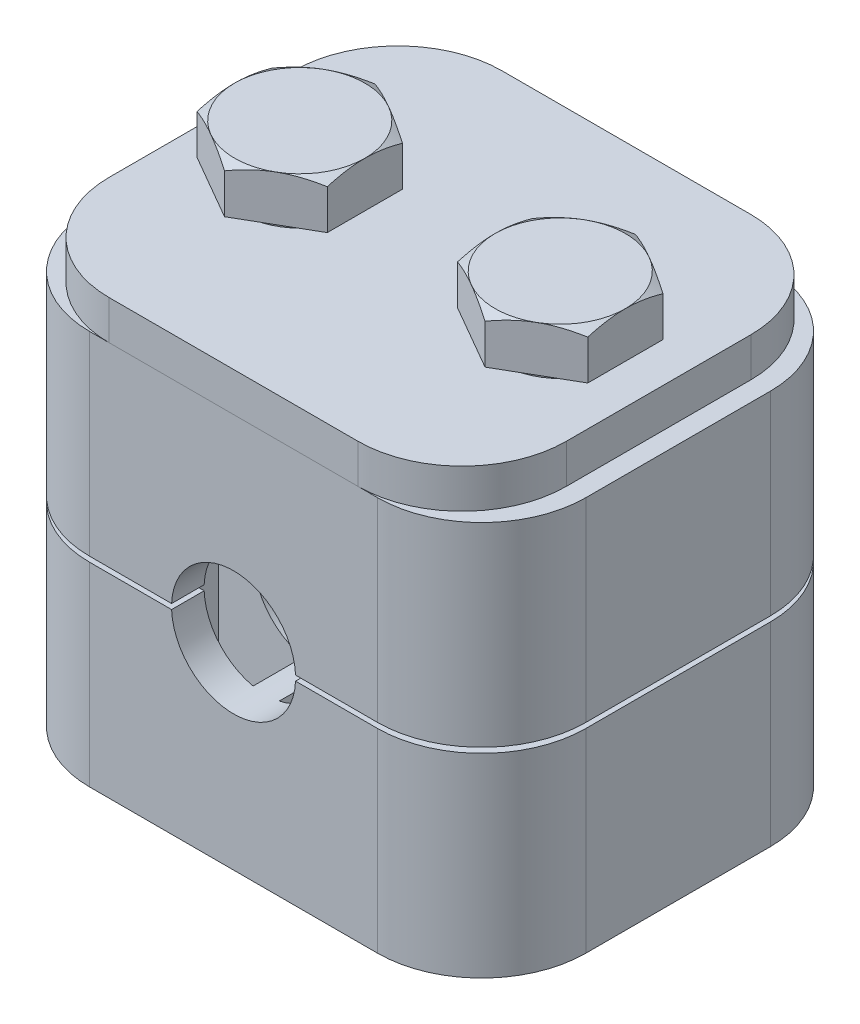
from build123d import *
from build123d.topology import SkipClean

# Parameters (mm, degrees)
SKETCH2_W                       = 38.1
SKETCH2_H                       = 30.2895
BOSS_EXTRUDE1_DEPTH             = 15.08125
FILLET1_R                       = 8
CUT_EXTRUDE1_DEPTH              = 29.630579004
CUT_EXTRUDE1_DEPTH_BACK         = 29.630579004
SKETCH3_R                       = 3.25
SKETCH4_R                       = 6
CUT_EXTRUDE2_DEPTH              = 7.5
CHAMFER1_SIZE                   = 1
CHAMFER1_OF_MIRROR2_SIZE        = 1
SHELL1_START                    = -12.64475
SHELL1_DEPTH                    = 25.2895
SHELL1_START_2                  = -5.14475
SHELL1_2_OUTLINE_R              = 5.75
SHELL1_2_DEPTH                  = 10.2895
BOSS_EXTRUDE5_START             = -12.58125
SKETCH17_W                      = 2
SKETCH17_H                      = 25.2895
BOSS_EXTRUDE5_DEPTH             = 25.1625
BOSS_EXTRUDE2_REACH             = 30.631
SKETCH7_W                       = 2.5
SKETCH7_H                       = 25.2895
BOSS_EXTRUDE2_DIRECTION_2_REACH = 30.631
BOSS_EXTRUDE8_START             = -16.55
SKETCH20_W                      = 3
SKETCH20_H                      = 25.2895
BOSS_EXTRUDE8_DEPTH             = 33.1
CUT_EXTRUDE3_DEPTH              = 29.630579004
CUT_EXTRUDE3_DEPTH_BACK         = 29.630579004
SKETCH5_W                       = 38.1
SKETCH5_H                       = 0.4
CUT_EXTRUDE4_DEPTH              = 29.630579004
CUT_EXTRUDE4_DEPTH_BACK         = 29.630579004
SKETCH11_R                      = 4.7625
SKETCH13_R                      = 3.5
BOSS_EXTRUDE3_DEPTH             = 3
CHAMFER3_SIZE                   = 0.5
BOSS_EXTRUDE4_DEPTH             = 3.5
SKETCH16_OUTSIDE_W              = 209.99
SKETCH16_OUTSIDE_H              = 202.052
SKETCH16_OUTSIDE_R              = 5
CUT_EXTRUDE5_DEPTH              = 45.506779425
CUT_EXTRUDE5_DRAFT              = -60


# Read off the part's stored shape, not the designer's step: Shell1
with BuildPart() as part:
    # Sketch2 → Boss-Extrude1 (new, symmetric)
    with BuildSketch(Plane.XY):
        Rectangle(SKETCH2_W, SKETCH2_H)
    extrude(amount=BOSS_EXTRUDE1_DEPTH, both=True)

    # Fillet1
    fillet1_edges = [part.edges().sort_by_distance(p)[0] for p in [
        (19.05, 0, 15.08125),
        (-19.05, 0, 15.08125),
        (19.05, 0, -15.08125),
        (-19.05, 0, -15.08125),
    ]]
    fillet(fillet1_edges, radius=FILLET1_R)

    # Sketch3 → Cut-Extrude1 (cut, two sides: drawn at the far end of the back side and taken through both)
    with BuildSketch(Plane(origin=(0, 0, 0), x_dir=(1, 0, 0), z_dir=(0, 1, 0)).offset(-CUT_EXTRUDE1_DEPTH_BACK)):
        with Locations(Location((-10, 0, 0), (0, 0, 270))):
            Circle(SKETCH3_R)
        with Locations(Location((10, 0, 0), (0, 0, 270))):
            Circle(SKETCH3_R)
    extrude(amount=CUT_EXTRUDE1_DEPTH + CUT_EXTRUDE1_DEPTH_BACK, mode=Mode.SUBTRACT)

    # Sketch4 → Cut-Extrude2 (cut)
    with BuildSketch(Plane(origin=(0, 15.14475, 0), x_dir=(1, 0, 0), z_dir=(0, 1, 0))):
        with Locations(Location((-10, 0, 0), (0, 0, 270))):
            Circle(SKETCH4_R)
        with Locations(Location((10, 0, 0), (0, 0, 270))):
            Circle(SKETCH4_R)
    cut_extrude2 = extrude(amount=-CUT_EXTRUDE2_DEPTH, mode=Mode.SUBTRACT)

    # Chamfer1
    chamfer1_edges = [part.edges().sort_by_distance(p)[0] for p in [
        (-10, 15.14475, -6),
        (10, 15.14475, -6),
    ]]
    chamfer(chamfer1_edges, length=CHAMFER1_SIZE)

    # Mirror2: Cut-Extrude2 across plane
    add(cut_extrude2.mirror(Plane.ZX), mode=Mode.SUBTRACT)

    # Chamfer1 of Mirror2
    chamfer1_of_mirror2_edges = [part.edges().sort_by_distance(p)[0] for p in [
        (-10, -15.14475, -6),
        (10, -15.14475, -6),
    ]]
    chamfer(chamfer1_of_mirror2_edges, length=CHAMFER1_OF_MIRROR2_SIZE)

    # Shell1 outline → Shell1 (cut)
    with BuildSketch(Plane(origin=(0, 0, 0), x_dir=(1, 0, 0), z_dir=(0, 1, 0)).offset(SHELL1_START)):
        with BuildLine():
            Line((-16.55, 7.08125), (-16.55, 5.417333292))
            ThreePointArc((-16.55, 5.417333292), (-1.5, 0), (-16.55, -5.417333292))
            Line((-16.55, -5.417333292), (-16.55, -7.08125))
            ThreePointArc((-16.55, -7.08125), (-14.939087297, -10.970337297), (-11.05, -12.58125))
            Line((-11.05, -12.58125), (11.05, -12.58125))
            ThreePointArc((11.05, -12.58125), (14.939087297, -10.970337297), (16.55, -7.08125))
            Line((16.55, -7.08125), (16.55, -5.417333292))
            ThreePointArc((16.55, -5.417333292), (1.5, 0), (16.55, 5.417333292))
            Line((16.55, 5.417333292), (16.55, 7.08125))
            ThreePointArc((16.55, 7.08125), (14.939087297, 10.970337297), (11.05, 12.58125))
            Line((11.05, 12.58125), (-11.05, 12.58125))
            ThreePointArc((-11.05, 12.58125), (-14.939087297, 10.970337297), (-16.55, 7.08125))
        make_face()
    extrude(amount=SHELL1_DEPTH, mode=Mode.SUBTRACT)

    # Shell1 2 outline → Shell1 2 (cut)
    # profile 1 of 2: a face of its own
    with BuildSketch(Plane(origin=(0, 0, 0), x_dir=(1, 0, 0), z_dir=(0, 1, 0)).offset(SHELL1_START_2)):
        with BuildLine():
            ThreePointArc((-16.55, -5.417333292), (-1.5, 0), (-16.55, 5.417333292))
            Line((-16.55, 5.417333292), (-16.55, -5.417333292))
        make_face()
        with Locations((-10, 0)):
            Circle(SHELL1_2_OUTLINE_R, mode=Mode.SUBTRACT)
    # profile 2 of 2: a face of its own
    with BuildSketch(Plane(origin=(0, 0, 0), x_dir=(1, 0, 0), z_dir=(0, 1, 0)).offset(SHELL1_START_2)):
        with BuildLine():
            Line((16.55, -5.417333292), (16.55, 5.417333292))
            ThreePointArc((16.55, 5.417333292), (1.5, 0), (16.55, -5.417333292))
        make_face()
        with Locations((10, 0)):
            Circle(SHELL1_2_OUTLINE_R, mode=Mode.SUBTRACT)
    extrude(amount=SHELL1_2_DEPTH, mode=Mode.SUBTRACT)

    # Sketch17 → Boss-Extrude5 (add)
    with BuildSketch(Plane.XY.offset(BOSS_EXTRUDE5_START)):
        Rectangle(SKETCH17_W, SKETCH17_H)
        with Locations((-8.5, 0)):
            Rectangle(SKETCH17_W, SKETCH17_H)
        with Locations((8.5, 0)):
            Rectangle(SKETCH17_W, SKETCH17_H)
    extrude(amount=BOSS_EXTRUDE5_DEPTH)

    # Boss-Extrude2: up to this face of the body (flat: up to its plane)
    boss_extrude2_end = Plane(part.part.faces().sort_by_distance((-7.5, 0, 9.568181511))[0])
    # Sketch7 → Boss-Extrude2 (add, up to the picked face)
    with BuildSketch(Plane(origin=(0, 0, 0), x_dir=(0, 0, -1), z_dir=(1, 0, 0)), mode=Mode.PRIVATE) as boss_extrude2_sk1:
        with Locations((-7.5, 0)):
            Rectangle(SKETCH7_W, SKETCH7_H)
    boss_extrude2_tool1 = split(extrude(boss_extrude2_sk1.sketch, amount=-BOSS_EXTRUDE2_REACH, mode=Mode.PRIVATE), bisect_by=boss_extrude2_end, keep=Keep.BOTH, mode=Mode.PRIVATE)
    # Sketch7 → Boss-Extrude2 (add, up to the picked face)
    with BuildSketch(Plane(origin=(0, 0, 0), x_dir=(0, 0, -1), z_dir=(1, 0, 0)), mode=Mode.PRIVATE) as boss_extrude2_sk2:
        with Locations((7.5, 0)):
            Rectangle(SKETCH7_W, SKETCH7_H)
    boss_extrude2_tool2 = split(extrude(boss_extrude2_sk2.sketch, amount=-BOSS_EXTRUDE2_REACH, mode=Mode.PRIVATE), bisect_by=boss_extrude2_end, keep=Keep.BOTH, mode=Mode.PRIVATE)
    add(boss_extrude2_tool1.solids().sort_by(Axis((0, 0, 7.5), (-1, 0, 0)))[0])
    add(boss_extrude2_tool2.solids().sort_by(Axis((0, 0, -7.5), (-1, 0, 0)))[0])

    # Boss-Extrude2 direction 2: up to this face of the body (flat: up to its plane)
    boss_extrude2_direction_2_end = Plane(part.part.faces().sort_by_distance((7.5, 0, 9.568181511))[0])
    # Sketch7 → Boss-Extrude2 direction 2 (add, up to the picked face)
    with BuildSketch(Plane(origin=(0, 0, 0), x_dir=(0, 0, -1), z_dir=(1, 0, 0)), mode=Mode.PRIVATE) as boss_extrude2_direction_2_sk1:
        with Locations((-7.5, 0)):
            Rectangle(SKETCH7_W, SKETCH7_H)
    boss_extrude2_direction_2_tool1 = split(extrude(boss_extrude2_direction_2_sk1.sketch, amount=BOSS_EXTRUDE2_DIRECTION_2_REACH, mode=Mode.PRIVATE), bisect_by=boss_extrude2_direction_2_end, keep=Keep.BOTH, mode=Mode.PRIVATE)
    # Sketch7 → Boss-Extrude2 direction 2 (add, up to the picked face)
    with BuildSketch(Plane(origin=(0, 0, 0), x_dir=(0, 0, -1), z_dir=(1, 0, 0)), mode=Mode.PRIVATE) as boss_extrude2_direction_2_sk2:
        with Locations((7.5, 0)):
            Rectangle(SKETCH7_W, SKETCH7_H)
    boss_extrude2_direction_2_tool2 = split(extrude(boss_extrude2_direction_2_sk2.sketch, amount=BOSS_EXTRUDE2_DIRECTION_2_REACH, mode=Mode.PRIVATE), bisect_by=boss_extrude2_direction_2_end, keep=Keep.BOTH, mode=Mode.PRIVATE)
    add(boss_extrude2_direction_2_tool1.solids().sort_by(Axis((0, 0, 7.5), (1, 0, 0)))[0])
    add(boss_extrude2_direction_2_tool2.solids().sort_by(Axis((0, 0, -7.5), (1, 0, 0)))[0])

    # Sketch20 → Boss-Extrude8 (add)
    with BuildSketch(Plane(origin=(0, 0, 0), x_dir=(0, 0, -1), z_dir=(1, 0, 0)).offset(BOSS_EXTRUDE8_START)):
        Rectangle(SKETCH20_W, SKETCH20_H)
    extrude(amount=BOSS_EXTRUDE8_DEPTH)

    # Sketch10 → Cut-Revolve1 (revolve, cut)
    with SkipClean():  # the faces are left unmerged after this step: merging them gives an invalid solid
        with BuildSketch(Plane.XY, mode=Mode.PRIVATE) as cut_revolve1_sk:
            Polygon((-16, 15.14475), (-10, 15.14475), (-10, -15.14475), (-16, -15.14475), (-16, -7.64475), (-13.25, -7.64475), (-13.25, 7.64475), (-16, 7.64475), align=None)
        cut_revolve1 = revolve(cut_revolve1_sk.sketch.rotate(Axis((-10, 15.14475, 0), (0, -1, 0)), 90), axis=Axis((-10, 15.14475, 0), (0, -1, 0)), mode=Mode.SUBTRACT)
    add(part.part.scale(1), mode=Mode.REPLACE)  # the faces are merged on a copy

    # Mirror11: Cut-Revolve1 across plane
    add(cut_revolve1.mirror(Plane(origin=(0, 0, 0), x_dir=(0, 0, 1), z_dir=(1, 0, 0))), mode=Mode.SUBTRACT)

    # Sketch5 → Cut-Extrude3 (cut, two sides: drawn at the far end of the back side and taken through both)
    with SkipClean():  # the faces are left unmerged after this step: merging them gives an invalid solid
        with BuildSketch(Plane.XY.offset(-CUT_EXTRUDE3_DEPTH_BACK)):
            Rectangle(SKETCH5_W, SKETCH5_H)
        extrude(amount=CUT_EXTRUDE3_DEPTH + CUT_EXTRUDE3_DEPTH_BACK, mode=Mode.SUBTRACT)


with BuildPart() as cut_extrude3_piece_1:
    # of the separate pieces the step leaves, piece 1, a body of its own (cut_extrude3_pieces)
    add(part.part.solids().sort_by_distance((-10, -15.14475, 7))[0])


with BuildPart() as cut_extrude3_piece_2:
    # of the separate pieces the step leaves, piece 2, a body of its own (cut_extrude3_pieces)
    add(part.part.solids().sort_by_distance((-11.05, 0.2, -15.08125))[0])


with BuildPart() as cut_extrude4_tool:
    # Sketch11 → Cut-Extrude4 (new, two sides: drawn at the far end of the back side and taken through both)
    with SkipClean():  # the faces are left unmerged after this step: merging them gives an invalid solid
        with BuildSketch(Plane.XY.offset(-CUT_EXTRUDE4_DEPTH_BACK)):
            Circle(SKETCH11_R)
        extrude(amount=CUT_EXTRUDE4_DEPTH + CUT_EXTRUDE4_DEPTH_BACK)


with BuildPart() as cut_extrude3_piece_1_1:
    with SkipClean():  # the faces are left unmerged after this step: merging them gives an invalid solid
        add(cut_extrude3_piece_1.part)

        # Cut-Extrude4: cut by cut_extrude4_tool
        add(cut_extrude4_tool.part, mode=Mode.SUBTRACT)


with BuildPart() as cut_extrude3_piece_2_1:
    with SkipClean():  # the faces are left unmerged after this step: merging them gives an invalid solid
        add(cut_extrude3_piece_2.part)

        # Cut-Extrude4: cut by cut_extrude4_tool
        add(cut_extrude4_tool.part, mode=Mode.SUBTRACT)


with BuildPart() as body_3:
    # Sketch13 → Boss-Extrude3 (new body)
    with BuildSketch(Plane(origin=(0, 15.14475, 0), x_dir=(1, 0, 0), z_dir=(0, 1, 0))):
        with BuildLine():
            Line((-9.55, 15.08125), (9.55, 15.08125))
            ThreePointArc((9.55, 15.08125), (15.206854249, 12.738104249), (17.55, 7.08125))
            Line((17.55, 7.08125), (17.55, -7.08125))
            ThreePointArc((17.55, -7.08125), (15.206854249, -12.738104249), (9.55, -15.08125))
            Line((9.55, -15.08125), (-9.55, -15.08125))
            ThreePointArc((-9.55, -15.08125), (-15.206854249, -12.738104249), (-17.55, -7.08125))
            Line((-17.55, -7.08125), (-17.55, 7.08125))
            ThreePointArc((-17.55, 7.08125), (-15.206854249, 12.738104249), (-9.55, 15.08125))
        make_face()
        with Locations(Location((-10, 0, 0), (0, 0, 270))):
            Circle(SKETCH13_R, mode=Mode.SUBTRACT)
        with Locations(Location((10, 0, 0), (0, 0, 270))):
            Circle(SKETCH13_R, mode=Mode.SUBTRACT)
    extrude(amount=BOSS_EXTRUDE3_DEPTH)


with BuildPart() as body_4:
    # Sketch14 → Revolve1 (revolve)
    with BuildSketch(Plane.XY, mode=Mode.PRIVATE) as revolve1_sk:
        Polygon((-13, 18.14475), (-13, -13.60525), (-10, -13.60525), (-10, 22.14475), (-15, 22.14475), (-15, 18.64475), (-14.45, 18.64475), (-14.45, 18.14475), align=None)
    revolve(revolve1_sk.sketch.rotate(Axis((-10, -13.60525, 0), (0, 1, 0)), 270), axis=Axis((-10, -13.60525, 0), (0, 1, 0)))

    # Chamfer3
    chamfer3_edges = [body_4.edges().sort_by_distance(p)[0] for p in [
        (-10, -13.60525, 3),
    ]]
    chamfer(chamfer3_edges, length=CHAMFER3_SIZE)

    # Sketch15 → Boss-Extrude4 (add)
    with BuildSketch(Plane(origin=(0, 22.14475, 0), x_dir=(1, 0, 0), z_dir=(0, 1, 0))):
        Polygon((-15, -2.886751346), (-10, -5.773502692), (-5, -2.886751346), (-5, 2.886751346), (-10, 5.773502692), (-15, 2.886751346), align=None)
    extrude(amount=-BOSS_EXTRUDE4_DEPTH)


with BuildPart() as cut_extrude5_tool:
    # Sketch16 outside → Cut-Extrude5 (with draft: the straight prism first)
    with BuildSketch(Plane(origin=(0, 22.14475, 0), x_dir=(1, 0, 0), z_dir=(0, 1, 0))):
        Rectangle(SKETCH16_OUTSIDE_W, SKETCH16_OUTSIDE_H)
        with Locations((-10, 0)):
            Circle(SKETCH16_OUTSIDE_R, mode=Mode.SUBTRACT)
    extrude(amount=-CUT_EXTRUDE5_DEPTH)
    # Cut-Extrude5: the draft: its side faces are tilted about the plane it starts from
    cut_extrude5_sides = [cut_extrude5_tool.faces().sort_by_distance(p)[0] for p in [
        (0, -0.608639713, 101.026),
        (104.995, -0.608639713, 0),
        (0, -0.608639713, -101.026),
        (-104.995, -0.608639713, 0),
        (-15, -0.608639713, 0),
    ]]
    draft(cut_extrude5_sides, Plane(origin=(0, 22.14475, 0), x_dir=(1, 0, 0), z_dir=(0, 1, 0)), CUT_EXTRUDE5_DRAFT)


with BuildPart() as body_4_1:
    add(body_4.part)

    # Cut-Extrude5: cut by cut_extrude5_tool
    add(cut_extrude5_tool.part, mode=Mode.SUBTRACT)


with BuildPart() as body_5:
    # Mirror12: mirrored copy
    add(body_4_1.part.mirror(Plane(origin=(0, 0, 0), x_dir=(0, 0, 1), z_dir=(1, 0, 0))))


solid = Compound([cut_extrude3_piece_1_1.part, cut_extrude3_piece_2_1.part, body_3.part, body_4_1.part, body_5.part])
